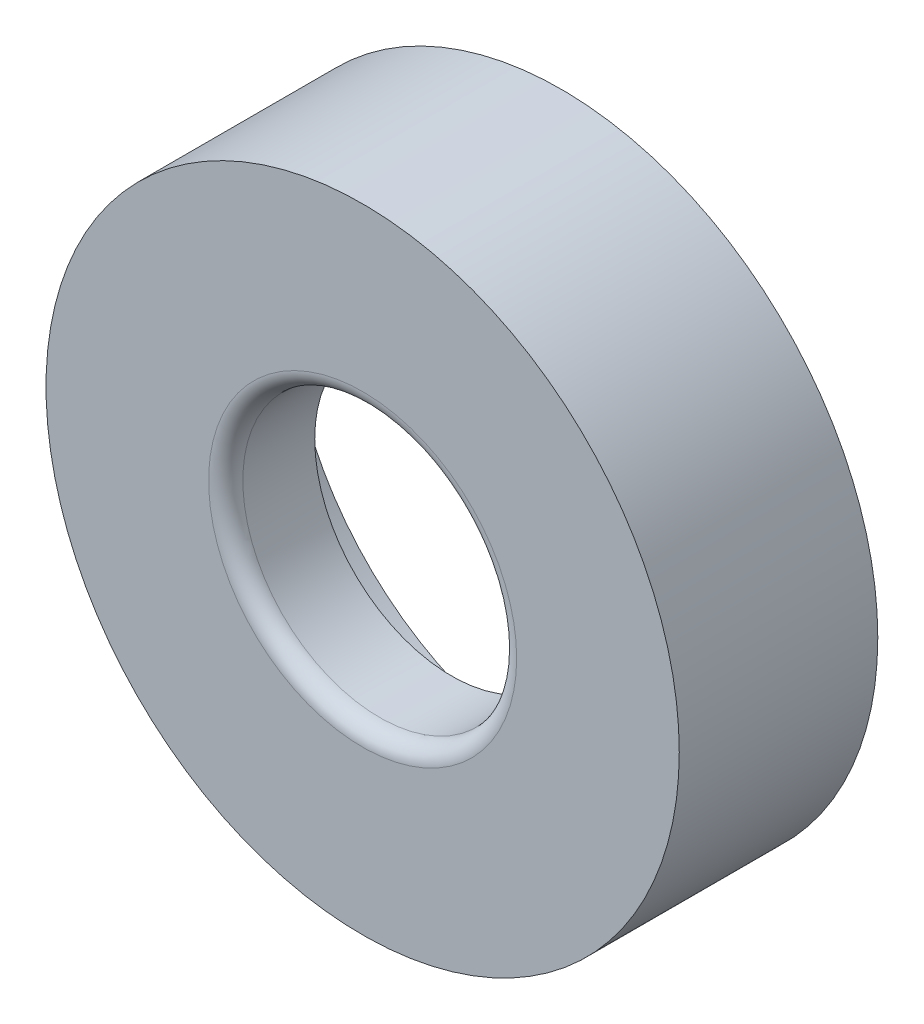
from build123d import *

# Parameters (mm, degrees)
SKETCH1_R           = 9.25
BOSS_EXTRUDE1_DEPTH = 5.8
SKETCH2_R           = 4
CUT_EXTRUDE1_DEPTH  = 96.273205671
SKETCH3_R           = 7.95
CUT_EXTRUDE2_DEPTH  = 3.2
FILLET1_R           = 0.5


with BuildPart() as part:
    # Sketch1 → Boss-Extrude1 (new body)
    with BuildSketch(Plane.XY):
        with Locations((85.206527413, -1.763997815)):
            Circle(SKETCH1_R)
    extrude(amount=BOSS_EXTRUDE1_DEPTH)

    # Sketch2 → Cut-Extrude1 (cut, through all)
    with BuildSketch(Plane.XY.offset(5.8)):
        with Locations((85.206527413, -1.763997815)):
            Circle(SKETCH2_R)
    extrude(amount=-CUT_EXTRUDE1_DEPTH, mode=Mode.SUBTRACT)

    # Sketch3 → Cut-Extrude2 (cut)
    with BuildSketch(Plane(origin=(0, 0, 0), x_dir=(-1, 0, 0), z_dir=(0, 0, -1))):
        with Locations((-85.206527413, -1.763997815)):
            Circle(SKETCH3_R)
    extrude(amount=-CUT_EXTRUDE2_DEPTH, mode=Mode.SUBTRACT)

    # Fillet1
    fillet1_edges = [part.edges().sort_by_distance(p)[0] for p in [
        (81.206527413, -1.763997815, 5.8),
    ]]
    fillet(fillet1_edges, radius=FILLET1_R)


solid = part.part
